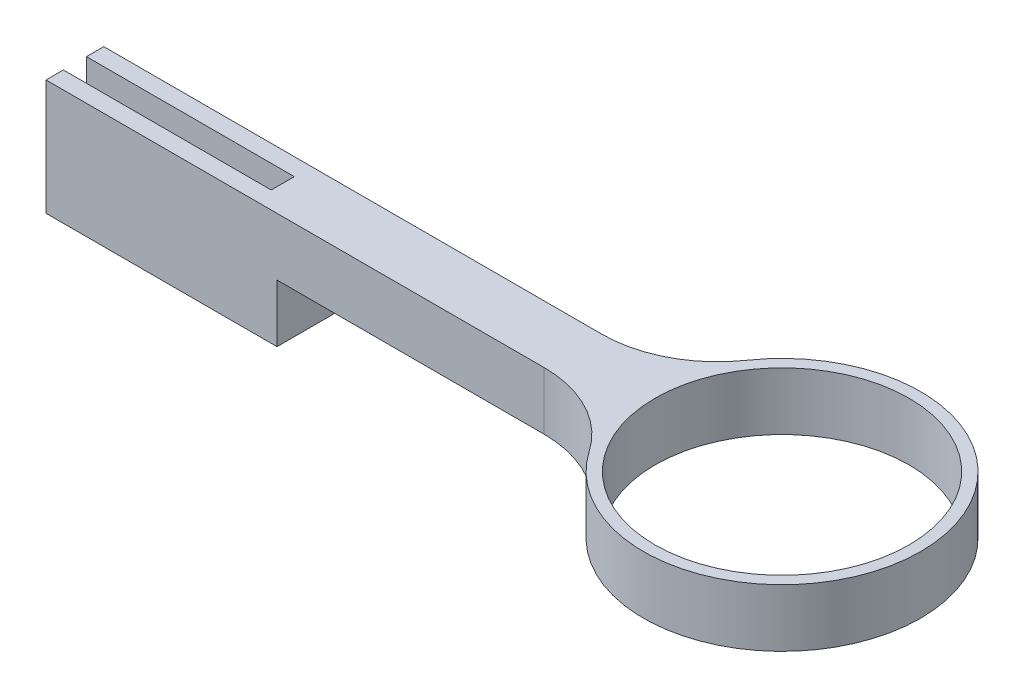
from build123d import *

# Parameters (mm, degrees)
SKETCH_1_R   = 12
SKETCH_1_R_2 = 11
RING_DEPTH   = 5
SKETCH_2_W   = 50
SKETCH_2_H   = 5
STICK_DEPTH  = 5
SKETCH_3_W   = 20
SKETCH_3_H   = 5
KEY_DEPTH    = 5
FILLET_1_R   = 10
SKETCH_5_W   = 2
SKETCH_5_H   = 10
SLOT_DEPTH   = 18


with BuildPart() as part:
    # Эскиз1 → ring (new body)
    with BuildSketch(Plane(origin=(0, 0, 0), x_dir=(1, 0, 0), z_dir=(0, 1, 0))):
        Circle(SKETCH_1_R)
        Circle(SKETCH_1_R_2, mode=Mode.SUBTRACT)
    extrude(amount=RING_DEPTH)

    # Эскиз2 → stick (add)
    with BuildSketch(Plane(origin=(0, 0, 0), x_dir=(1, 0, 0), z_dir=(0, 1, 0))):
        with Locations((-36.22497216, 0)):
            Rectangle(SKETCH_2_W, SKETCH_2_H)
    extrude(amount=STICK_DEPTH)

    # Эскиз3 → key (add)
    with BuildSketch(Plane(origin=(0, 0, 0), x_dir=(1, 0, 0), z_dir=(0, 1, 0))):
        with Locations((-51.22497216, 0)):
            Rectangle(SKETCH_3_W, SKETCH_3_H)
    extrude(amount=-KEY_DEPTH)

    # Скругление1
    fillet_1_edges = [part.edges().sort_by_distance(p)[0] for p in [
        (-11.736694594, 2.5, 2.5),
        (-11.736694594, 2.5, -2.5),
    ]]
    fillet(fillet_1_edges, radius=FILLET_1_R)

    # Эскиз5 → slot (cut)
    with BuildSketch(Plane.ZY.offset(61.22497216)):
        Rectangle(SKETCH_5_W, SKETCH_5_H)
    extrude(amount=-SLOT_DEPTH, mode=Mode.SUBTRACT)


solid = part.part
